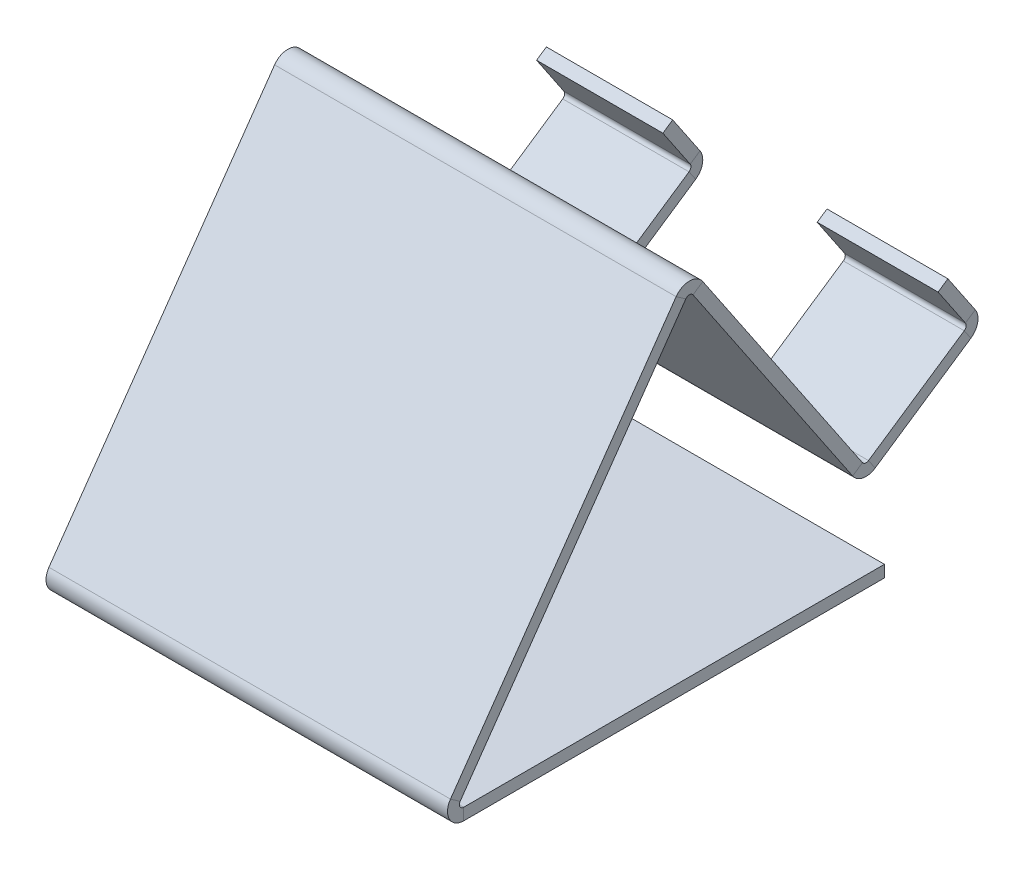
from build123d import *

# Parameters (mm, degrees)
SKETCH1_W                      = 67.895404789
SKETCH1_H                      = 2
BASE_FLANGE1_DEPTH             = 37.5
EDGE_FLANGE1_START             = -28.961034246
EDGE_FLANGE1_DEPTH             = 67.895404789
EDGE_FLANGE1_2_DEPTH           = 67.895404789
EDGE_FLANGE2_START             = -28.961034246
EDGE_FLANGE2_DEPTH             = 67.895404789
EDGE_FLANGE2_2_DEPTH           = 67.895404789
EDGE_FLANGE3_STRIP_W           = 9.4732
EDGE_FLANGE3_STRIP_H           = 2
EDGE_FLANGE3_STRIP_CUT_DEPTH   = 67.89540479
EDGE_FLANGE3_DEPTH             = 67.89540479
CUT_EXTRUDE1_REACH             = 92.8
SKETCH15_W                     = 26.092581692
SKETCH15_H                     = 22.2634
EDGE_FLANGE4_STRIP_W           = 9.4732
EDGE_FLANGE4_STRIP_H           = 2
EDGE_FLANGE4_STRIP_CUT_DEPTH   = 20.44630838
EDGE_FLANGE4_STRIP_2_W         = 9.4732
EDGE_FLANGE4_STRIP_2_H         = 2
EDGE_FLANGE4_STRIP_CUT_2_DEPTH = 21.356514718
EDGE_FLANGE4_DEPTH             = 20.44630838
EDGE_FLANGE4_BEND_DEPTH        = 21.356514718


# Read off the part's stored shape, not the designer's step: Edge-Flange1, Edge-Flange2
# Sheet-metal steps are written as plain solids
with BuildPart() as part:
    # Sketch1 → Base-Flange1 (new, symmetric)
    with BuildSketch(Plane.XY):
        with Locations((4.986668148, 1)):
            Rectangle(SKETCH1_W, SKETCH1_H)
    extrude(amount=BASE_FLANGE1_DEPTH, both=True)

    # Edge-Flange1 outline → Edge-Flange1 (cut)
    with BuildSketch(Plane.YZ.offset(EDGE_FLANGE1_START)):
        with BuildLine():
            ThreePointArc((0, 33.643455388), (0.556604688, 35.297722597), (2, 36.279057786))
            Line((2, 36.279057786), (2, 37.5))
            Line((2, 37.5), (0, 37.5))
            Line((0, 37.5), (0, 33.643455388))
        make_face()
    extrude(amount=EDGE_FLANGE1_DEPTH, mode=Mode.SUBTRACT)

    # Edge-Flange1 2 outline → Edge-Flange1 2 (add)
    with BuildSketch(Plane.YZ.offset(EDGE_FLANGE1_START)):
        with BuildLine():
            Line((61.436403322, -4.11781765), (4.306249276, 35.885146872))
            ThreePointArc((4.306249276, 35.885146872), (3.197343124, 36.340990436), (2, 36.279057786))
            Line((2, 36.279057786), (2, 33.643455388))
            ThreePointArc((2, 33.643455388), (2.396475972, 34.296827567), (3.159096403, 34.246842784))
            Line((3.159096403, 34.246842784), (60.289250449, -5.756121738))
            Line((60.289250449, -5.756121738), (61.436403322, -4.11781765))
        make_face()
    extrude(amount=EDGE_FLANGE1_2_DEPTH)

    # Edge-Flange2 outline → Edge-Flange2 (cut)
    with BuildSketch(Plane.YZ.offset(EDGE_FLANGE2_START)):
        with BuildLine():
            ThreePointArc((58.80360799, -2.274314512), (59.839449023, -3.679107071), (59.81541421, -5.424338031))
            Line((59.81541421, -5.424338031), (60.289250449, -5.756121738))
            Line((60.289250449, -5.756121738), (61.436403322, -4.11781765))
            Line((61.436403322, -4.11781765), (58.80360799, -2.274314512))
        make_face()
    extrude(amount=EDGE_FLANGE2_DEPTH, mode=Mode.SUBTRACT)

    # Edge-Flange2 2 outline → Edge-Flange2 2 (add)
    with BuildSketch(Plane.YZ.offset(EDGE_FLANGE2_START)):
        with BuildLine():
            Line((16.468222849, -35.313778071), (58.764246014, -6.784750218))
            ThreePointArc((58.764246014, -6.784750218), (59.399434997, -6.189234023), (59.81541421, -5.424338031))
            Line((59.81541421, -5.424338031), (57.656455118, -3.912618601))
            ThreePointArc((57.656455118, -3.912618601), (57.970530667, -4.522433963), (57.645860207, -5.126675073))
            Line((57.645860207, -5.126675073), (15.349837042, -33.655702926))
            Line((15.349837042, -33.655702926), (16.468222849, -35.313778071))
        make_face()
    extrude(amount=EDGE_FLANGE2_2_DEPTH)

    # Edge-Flange3 strip (across the edge) → Edge-Flange3 strip cut (cut)
    with BuildSketch(Plane(origin=(38.934370543, 16.468222849, -35.313778071), x_dir=(0, 0.829037572555041, 0.5591929034707481), z_dir=(-1, 0, 0))):
        with Locations((-2, -1)):
            Rectangle(EDGE_FLANGE3_STRIP_W, EDGE_FLANGE3_STRIP_H)
    extrude(amount=EDGE_FLANGE3_STRIP_CUT_DEPTH, mode=Mode.SUBTRACT)

    # Edge-Flange3 section (across the edge) → Edge-Flange3 (add)
    with BuildSketch(Plane(origin=(38.934370543, 16.468222849, -35.313778071), x_dir=(0, 0.829037572555041, 0.5591929034707481), z_dir=(-1, 0, 0))):
        with BuildLine():
            Line((0, 0.7366), (0, 23))
            Line((0, 23), (2, 23))
            Line((2, 23), (2, 0.7366))
            ThreePointArc((2, 0.7366), (2.215745145, 0.215745145), (2.7366, 0))
            Line((2.7366, 0), (2.7366, -2))
            ThreePointArc((2.7366, -2), (0.801531583, -1.198468417), (0, 0.7366))
        make_face()
    extrude(amount=EDGE_FLANGE3_DEPTH)

    # Sketch15 → Cut-Extrude1 (cut, up to next)
    with BuildSketch(Plane(origin=(0, -3.394443435, -2.289581007), x_dir=(1, 0, 0), z_dir=(0, 0.8290375725550408, 0.559192903470748)), mode=Mode.PRIVATE) as cut_extrude1_sk1:
        with Locations((5.441771317, 50.3536622)):
            Rectangle(SKETCH15_W, SKETCH15_H)
    cut_extrude1_tool1 = extrude(cut_extrude1_sk1.sketch, amount=-CUT_EXTRUDE1_REACH, mode=Mode.PRIVATE) & part.part
    add(cut_extrude1_tool1.solids().sort_by_distance((5.441771, 24.762967, -44.034659))[0], mode=Mode.SUBTRACT)

    # Edge-Flange4 strip (across the edge) → Edge-Flange4 strip cut (cut)
    with BuildSketch(Plane(origin=(38.934370543, 30.987734774, -53.263256433), x_dir=(0, -0.5591929034707451, 0.8290375725550428), z_dir=(-1, 0, 0))):
        with Locations((-2, -1)):
            Rectangle(EDGE_FLANGE4_STRIP_W, EDGE_FLANGE4_STRIP_H)
    extrude(amount=EDGE_FLANGE4_STRIP_CUT_DEPTH, mode=Mode.SUBTRACT)

    # Edge-Flange4 strip 2 (across the edge) → Edge-Flange4 strip cut 2 (cut)
    with BuildSketch(Plane(origin=(-7.604519529, 30.987734774, -53.263256433), x_dir=(0, -0.5591929034707451, 0.8290375725550428), z_dir=(-1, 0, 0))):
        with Locations((-2, -1)):
            Rectangle(EDGE_FLANGE4_STRIP_2_W, EDGE_FLANGE4_STRIP_2_H)
    extrude(amount=EDGE_FLANGE4_STRIP_CUT_2_DEPTH, mode=Mode.SUBTRACT)

    # Edge-Flange4 section (across the edge) → Edge-Flange4 (add)
    with BuildSketch(Plane(origin=(38.934370543, 30.987734774, -53.263256433), x_dir=(0, -0.5591929034707451, 0.8290375725550428), z_dir=(-1, 0, 0))):
        with BuildLine():
            Line((0, 0.7366), (0, 9))
            Line((0, 9), (2, 9))
            Line((2, 9), (2, 0.7366))
            ThreePointArc((2, 0.7366), (2.215745145, 0.215745145), (2.7366, 0))
            Line((2.7366, 0), (2.7366, -2))
            ThreePointArc((2.7366, -2), (0.801531583, -1.198468417), (0, 0.7366))
        make_face()
    extrude(amount=EDGE_FLANGE4_DEPTH)

    # Edge-Flange4 section 2 (across the edge) → Edge-Flange4 bend (add)
    with BuildSketch(Plane(origin=(-7.604519529, 30.987734774, -53.263256433), x_dir=(0, -0.5591929034707451, 0.8290375725550428), z_dir=(-1, 0, 0))):
        with BuildLine():
            Line((0, 0.7366), (0, 9))
            Line((0, 9), (2, 9))
            Line((2, 9), (2, 0.7366))
            ThreePointArc((2, 0.7366), (2.215745145, 0.215745145), (2.7366, 0))
            Line((2.7366, 0), (2.7366, -2))
            ThreePointArc((2.7366, -2), (0.801531583, -1.198468417), (0, 0.7366))
        make_face()
    extrude(amount=EDGE_FLANGE4_BEND_DEPTH)


solid = part.part
